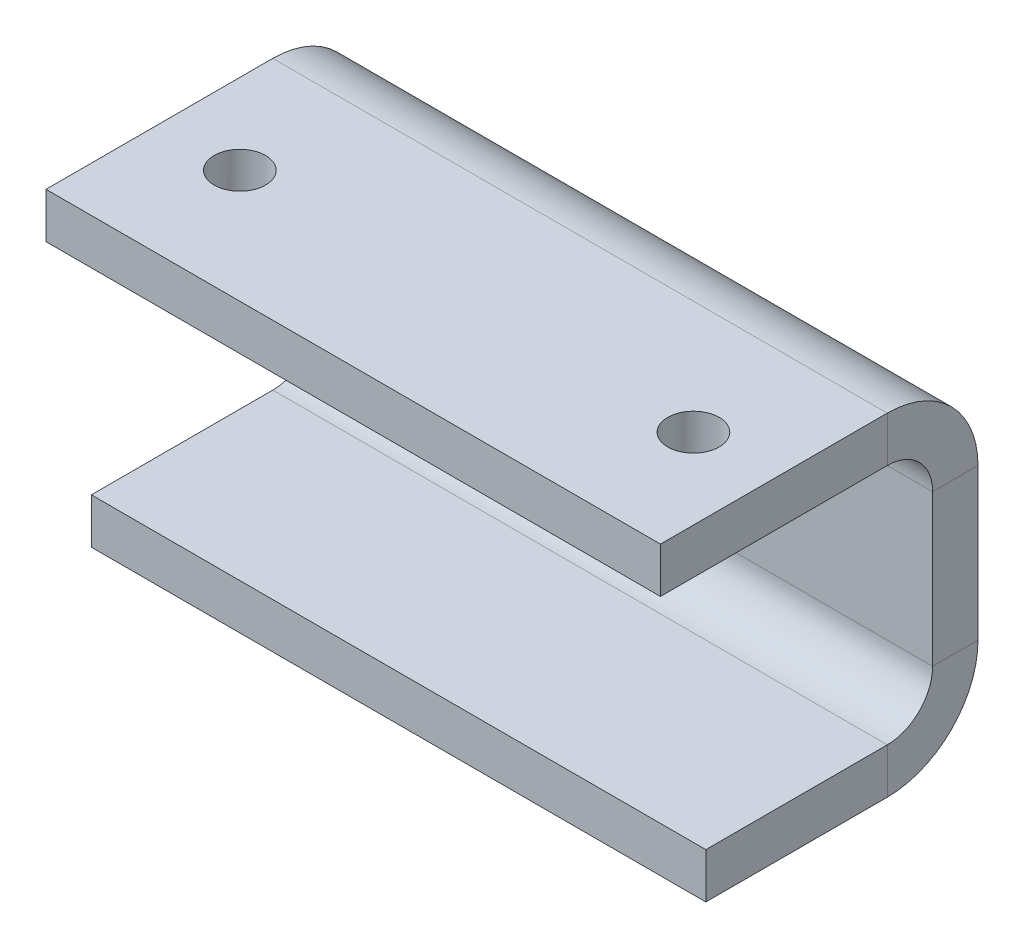
from build123d import *

# Parameters (mm, degrees)
SKETCH2_W                = 40.64
SKETCH2_H                = 15
BASE_FLANGE1_DEPTH       = 3
EDGE_FLANGE1_DEPTH       = 40.64
EDGE_FLANGE2_DEPTH       = 40.64
M3_CLEARANCE_HOLE1_D     = 3.4
M3_CLEARANCE_HOLE1_DEPTH = 3


# Sheet-metal steps are written as plain solids
with BuildPart() as part:
    # Sketch2 → Base-Flange1 (new body)
    with BuildSketch(Plane(origin=(0, 0, 0), x_dir=(1, 0, 0), z_dir=(0, 1, 0))):
        Rectangle(SKETCH2_W, SKETCH2_H)
    extrude(amount=-BASE_FLANGE1_DEPTH)

    # Edge-Flange1 section (across the edge) → Edge-Flange1 (add)
    with BuildSketch(Plane(origin=(-20.32, -3, -10.5), x_dir=(0, 0, 1), z_dir=(1, 0, 0))):
        with BuildLine():
            Line((-3, 3), (-3, 13))
            Line((-3, 13), (0, 13))
            Line((0, 13), (0, 3))
            ThreePointArc((0, 3), (0.878679656, 0.878679656), (3, 0))
            Line((3, 0), (3, -3))
            ThreePointArc((3, -3), (-1.242640687, -1.242640687), (-3, 3))
        make_face()
    extrude(amount=EDGE_FLANGE1_DEPTH)

    # Edge-Flange2 section (across the edge) → Edge-Flange2 (add)
    with BuildSketch(Plane(origin=(-20.32, -19, -10.5), x_dir=(0, 1, 0), z_dir=(1, 0, 0))):
        with BuildLine():
            Line((-3, 3), (-3, 15))
            Line((-3, 15), (0, 15))
            Line((0, 15), (0, 3))
            ThreePointArc((0, 3), (0.878679656, 0.878679656), (3, 0))
            Line((3, 0), (3, -3))
            ThreePointArc((3, -3), (-1.242640687, -1.242640687), (-3, 3))
        make_face()
    extrude(amount=EDGE_FLANGE2_DEPTH)

    # M3 Clearance Hole1
    with Locations(Plane(origin=(0, 0, 0), x_dir=(1, 0, 0), z_dir=(0, 1, 0))):
        with Locations((-15, 0), (15, 0)):
            Hole(M3_CLEARANCE_HOLE1_D / 2, depth=M3_CLEARANCE_HOLE1_DEPTH)


solid = part.part
